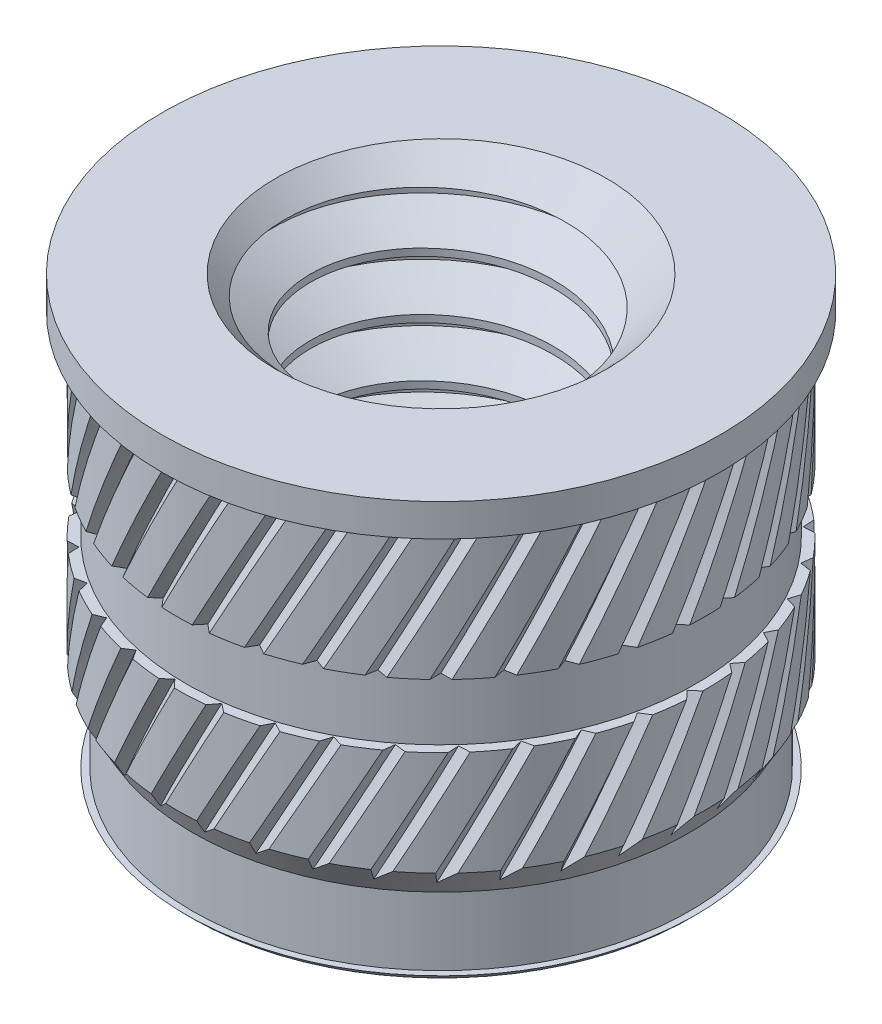
from build123d import *

# Parameters (mm, degrees)
SKETCH1_R         = 1.945
EXTRUDE1_DEPTH    = 3.4
SKETCH1_4_R       = 2.07
EXTRUDE2_DEPTH    = 2.601346
SKETCH1_3_R       = 2.185
EXTRUDE3_DEPTH    = 0.254
SKETCH2_R         = 2.07
EXTRUDE4_DEPTH    = 0.216506
EXTRUDE4_TAPER    = 30
SKETCH8_R         = 0.957716426
EXTRUDE6_DEPTH    = 3.4
CHAMFER1_SIZE     = 0.3375
CUT_SWEEP1_PITCH  = 0.45
CUT_SWEEP2_PITCH  = 24.7725
CIRPATTERN1_COUNT = 36
SKETCH11_W        = 0.19
SKETCH11_H        = 0.49545


# Read off the part's stored shape, not the designer's step: Extrude5
with BuildPart() as part:
    # Sketch1 → Extrude1 (new body)
    with BuildSketch(Plane(origin=(0, 0, 0), x_dir=(1, 0, 0), z_dir=(0, 1, 0))):
        with Locations(Location((0, 0, 0), (0, 0, 270))):
            Circle(SKETCH1_R)
    extrude(amount=-EXTRUDE1_DEPTH)

    # Sketch1<4> → Extrude2 (add)
    with BuildSketch(Plane(origin=(0, 0, 0), x_dir=(1, 0, 0), z_dir=(0, 1, 0))):
        with Locations(Location((0, 0, 0), (0, 0, 270))):
            Circle(SKETCH1_4_R)
    extrude(amount=-EXTRUDE2_DEPTH)

    # Sketch1<3> → Extrude3 (add)
    with BuildSketch(Plane(origin=(0, 0, 0), x_dir=(1, 0, 0), z_dir=(0, 1, 0))):
        with Locations(Location((0, 0, 0), (0, 0, 270))):
            Circle(SKETCH1_3_R)
    extrude(amount=-EXTRUDE3_DEPTH)

    # Sketch2 → Extrude4 (add)
    with BuildSketch(Plane.XZ.offset(2.601346189)):
        with Locations(Location((0, 0, 0), (0, 0, 90))):
            Circle(SKETCH2_R)
    extrude(amount=EXTRUDE4_DEPTH, taper=EXTRUDE4_TAPER)

    # Extrude5 outline → Extrude5 (revolve)
    with BuildSketch(Plane.XY):
        Polygon((1.945, -3.35), (1.945, -3.4), (1.995, -3.35), align=None)
    revolve(axis=Axis((0, 0, 0), (0, 1, 0)))

    # Sketch8 → Extrude6 (cut)
    with BuildSketch(Plane(origin=(0, 0, 0), x_dir=(1, 0, 0), z_dir=(0, 1, 0))):
        with Locations(Location((0, 0, 0), (0, 0, 270))):
            Circle(SKETCH8_R)
    extrude(amount=-EXTRUDE6_DEPTH, mode=Mode.SUBTRACT)

    # Chamfer1
    chamfer1_edges = [part.edges().sort_by_distance(p)[0] for p in [
        (0, -3.4, -0.957716426),
        (0, 0, -0.957716426),
    ]]
    chamfer(chamfer1_edges, length=CHAMFER1_SIZE)

    # Cut-Sweep1: the profile of Sketch7 screwed along a right-hand helix of 9.253687 turns, 6 arcs to a turn; built about Z, then put on its axis
    cut_sweep1_z = Axis((0, 0, 0), (0, 0, 1))
    cut_sweep1_corners = [(1.25, 0, -0.225), (1.25, 0, -0.16875), (0.933359462, 0, 0.0140625), (0.933359462, 0, -0.4078125)]
    with BuildLine(mode=Mode.PRIVATE) as cut_sweep1_profile:
        Line(cut_sweep1_corners[0], cut_sweep1_corners[1])
        Line(cut_sweep1_corners[1], cut_sweep1_corners[2])
        Line(cut_sweep1_corners[2], cut_sweep1_corners[3])
        Line(cut_sweep1_corners[3], cut_sweep1_corners[0])
    cut_sweep1_cap = Face(cut_sweep1_profile.wire())
    cut_sweep1_turn_angles = [0, 30, 60, 90, 120, 150, 180, 210, 240, 270, 300, 330, 360]
    cut_sweep1_turn_weights = [1, 0.8660254037844387, 1, 0.8660254037844387, 1, 0.8660254037844387, 1, 0.8660254037844387, 1, 0.8660254037844387, 1, 0.8660254037844387, 1]
    cut_sweep1_turn_rails = [Edge.make_bspline([Vector(p[0], p[1], 0).rotate(cut_sweep1_z, cut_sweep1_turn_angles[k]) / cut_sweep1_turn_weights[k] + Vector(0, 0, p[2] + CUT_SWEEP1_PITCH * cut_sweep1_turn_angles[k] / 360) for k in range(13)], [0, 0, 0, 1, 1, 2, 2, 3, 3, 4, 4, 5, 5, 6, 6, 6], 2, cut_sweep1_turn_weights) for p in cut_sweep1_corners]
    cut_sweep1_turn_sides = [Face.make_surface_from_curves(cut_sweep1_turn_rails[p[0]], cut_sweep1_turn_rails[p[1]]) for p in [(0, 1), (1, 2), (2, 3), (3, 0)]]
    cut_sweep1_last_angles = [3240, 3270, 3300, 3315.663706144, 3331.327412287]
    cut_sweep1_last_weights = [1, 0.8660254037844387, 1, 0.9628629643922332, 1]
    cut_sweep1_last_rails = [Edge.make_bspline([Vector(p[0], p[1], 0).rotate(cut_sweep1_z, cut_sweep1_last_angles[k]) / cut_sweep1_last_weights[k] + Vector(0, 0, p[2] + CUT_SWEEP1_PITCH * cut_sweep1_last_angles[k] / 360) for k in range(5)], [0, 0, 0, 1, 1, 2, 2, 2], 2, cut_sweep1_last_weights) for p in cut_sweep1_corners]
    cut_sweep1_last_sides = [Face.make_surface_from_curves(cut_sweep1_last_rails[p[0]], cut_sweep1_last_rails[p[1]]) for p in [(0, 1), (1, 2), (2, 3), (3, 0)]]
    cut_sweep1 = Plane(origin=(0, 0, 0), x_dir=(-1, 0, 0), z_dir=(0, -1, 0)) * Solid(Shell([*[p.moved(Location((0, 0, CUT_SWEEP1_PITCH * i))) for i in range(9) for p in cut_sweep1_turn_sides], *cut_sweep1_last_sides, cut_sweep1_cap, cut_sweep1_cap.rotate(cut_sweep1_z, 3331.327412287).moved(Location((0, 0, CUT_SWEEP1_PITCH * 3331.327412287 / 360)))]))
    add(cut_sweep1, mode=Mode.SUBTRACT)

    # Cut-Sweep2: the profile of Sketch10 screwed along a right-hand helix of 0.1 turns, 22 arcs to a turn; built about Z, then put on its axis
    cut_sweep2_z = Axis((0, 0, 0), (0, 0, 1))
    cut_sweep2_corners = [(2.0075, 0, 0), (2.07, 0.0625, 0), (2.07, -0.0625, 0)]
    with BuildLine(mode=Mode.PRIVATE) as cut_sweep2_profile:
        Line(cut_sweep2_corners[0], cut_sweep2_corners[1])
        Line(cut_sweep2_corners[1], cut_sweep2_corners[2])
        Line(cut_sweep2_corners[2], cut_sweep2_corners[0])
    cut_sweep2_cap = Face(cut_sweep2_profile.wire())
    cut_sweep2_turn_angles = [0, 8.181818182, 16.363636364, 24.545454545, 32.727272727, 34.363636364, 36]
    cut_sweep2_turn_weights = [1, 0.9898214418809327, 1, 0.9898214418809327, 1, 0.9995921928281892, 1]
    cut_sweep2_turn_rails = [Edge.make_bspline([Vector(p[0], p[1], 0).rotate(cut_sweep2_z, cut_sweep2_turn_angles[k]) / cut_sweep2_turn_weights[k] + Vector(0, 0, p[2] + CUT_SWEEP2_PITCH * cut_sweep2_turn_angles[k] / 360) for k in range(7)], [0, 0, 0, 1, 1, 2, 2, 3, 3, 3], 2, cut_sweep2_turn_weights) for p in cut_sweep2_corners]
    cut_sweep2_turn_sides = [Face.make_surface_from_curves(cut_sweep2_turn_rails[p[0]], cut_sweep2_turn_rails[p[1]]) for p in [(0, 1), (1, 2), (2, 0)]]
    cut_sweep2 = Plane(origin=(0, -0.254, 0), x_dir=(0, 0, 1), z_dir=(0, -1, 0)) * Solid(Shell([*cut_sweep2_turn_sides, cut_sweep2_cap, cut_sweep2_cap.rotate(cut_sweep2_z, 36).moved(Location((0, 0, CUT_SWEEP2_PITCH * 36 / 360)))]))
    add(cut_sweep2, mode=Mode.SUBTRACT)

    # CirPattern1: Cut-Sweep2 ×36 about axis
    cirpattern1_axis = Axis((0, -2.601346189, 0), (0, 1, 0))
    for i in range(1, CIRPATTERN1_COUNT):
        add(cut_sweep2.rotate(cirpattern1_axis, i * 360 / CIRPATTERN1_COUNT), mode=Mode.SUBTRACT)

    # Sketch11 → Cut-Revolve1 (revolve, cut)
    with BuildSketch(Plane.XY):
        with Locations((-2.09, -1.53592627)):
            Rectangle(SKETCH11_W, SKETCH11_H)
    revolve(axis=Axis((0, 0, 0), (0, -1, 0)), mode=Mode.SUBTRACT)


solid = part.part
